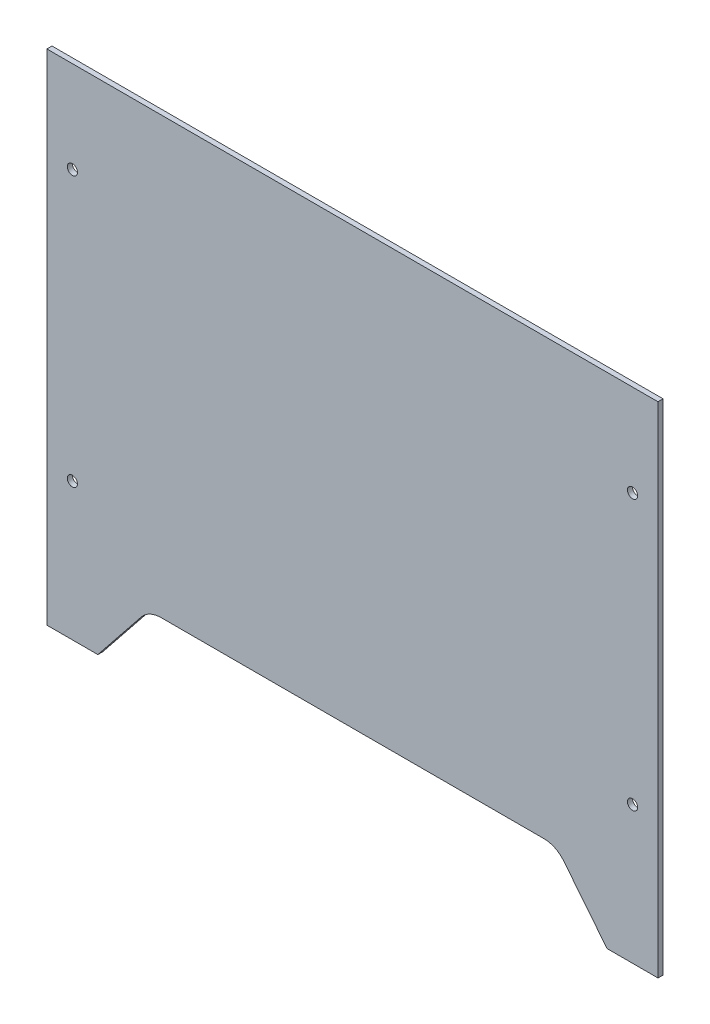
from build123d import *

# Parameters (mm, degrees)
SKETCH1_R           = 2
BOSS_EXTRUDE1_DEPTH = 2


with BuildPart() as part:
    # Sketch1 → Boss-Extrude1 (new body)
    with BuildSketch(Plane.XY):
        with BuildLine():
            Line((-120, -98), (-120, 98))
            Line((-120, 98), (120, 98))
            Line((120, 98), (120, -98))
            Line((120, -98), (100, -98))
            Line((100, -98), (83.00243962, -76.753049524))
            ThreePointArc((83.00243962, -76.753049524), (79.52563883, -73.986967637), (75.193751525, -73))
            Line((75.193751525, -73), (-75.193751525, -73))
            ThreePointArc((-75.193751525, -73), (-79.52563883, -73.986967637), (-83.00243962, -76.753049524))
            Line((-83.00243962, -76.753049524), (-100, -98))
            Line((-100, -98), (-120, -98))
        make_face()
        with Locations((110, 62)):
            Circle(SKETCH1_R, mode=Mode.SUBTRACT)
        with Locations((110, -44)):
            Circle(SKETCH1_R, mode=Mode.SUBTRACT)
        with Locations((-110, -44)):
            Circle(SKETCH1_R, mode=Mode.SUBTRACT)
        with Locations((-110, 62)):
            Circle(SKETCH1_R, mode=Mode.SUBTRACT)
    extrude(amount=BOSS_EXTRUDE1_DEPTH)


solid = part.part
